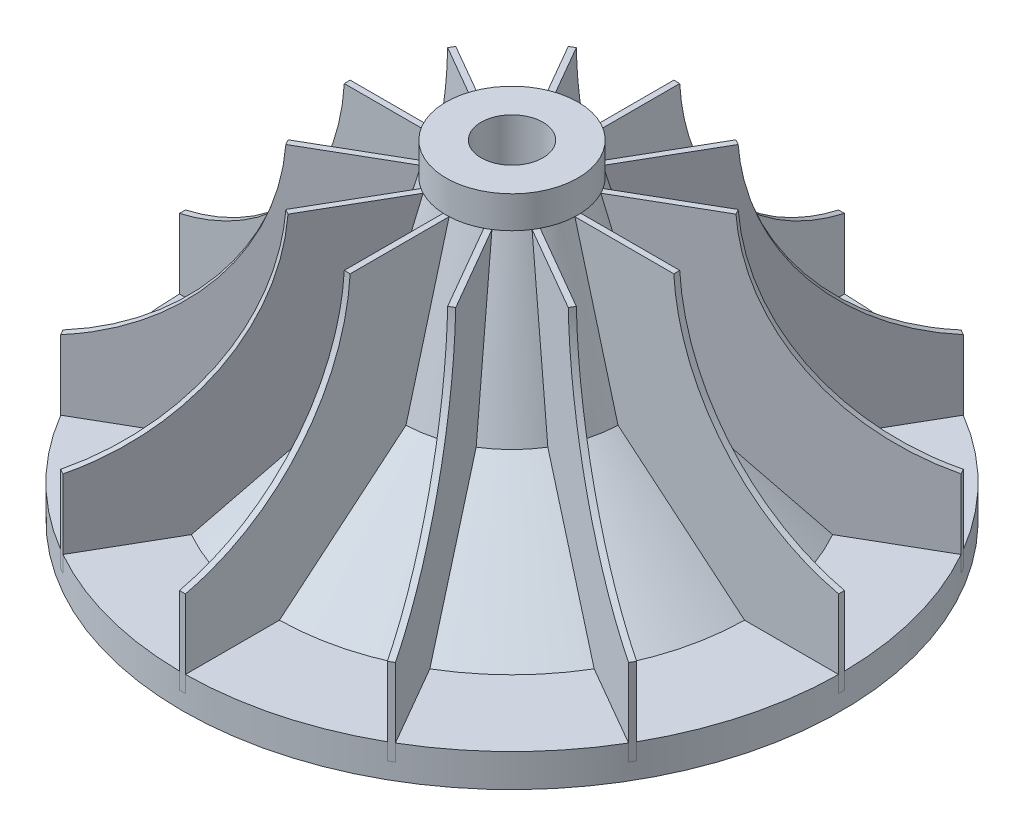
from build123d import *

# Parameters (mm, degrees)
SKETCH3_W           = 0.91186
SKETCH3_H           = 41.91
BOSS_EXTRUDE5_DEPTH = 48.26
CIRPATTERN8_COUNT   = 12
CUT_EXTRUDE1_REACH  = 89.988
SKETCH6_R           = 4.7625


with BuildPart() as part:
    # Sketch1 → Revolve1 (revolve)
    with BuildSketch(Plane.XY):
        Polygon((0, 0), (-50.8, 0), (-50.8, 5.08), (-36.306033809, 5.08), (-16.802789754, 21.352168612), (-10.16, 45.868150017), (-10.16, 50.8), (0, 50.8), align=None)
    revolve(axis=Axis((0, 0, 0), (0, 1, 0)))

    # Sketch3 → Boss-Extrude5 (add)
    with BuildSketch(Plane(origin=(0, 50.8, 0), x_dir=(1, 0, 0), z_dir=(0, 1, 0))):
        with Locations((0, -29.845)):
            Rectangle(SKETCH3_W, SKETCH3_H)
    boss_extrude5 = extrude(amount=-BOSS_EXTRUDE5_DEPTH)

    # CirPattern8: Boss-Extrude5 ×12 about axis
    cirpattern8_axis = Axis((0, 5.08, 0), (0, -1, 0))
    for i in range(1, CIRPATTERN8_COUNT):
        add(boss_extrude5.rotate(cirpattern8_axis, i * 360 / CIRPATTERN8_COUNT))

    # Sketch4 → Cut-Revolve1 (revolve, cut)
    with BuildSketch(Plane(origin=(0, 0, 0), x_dir=(0, 0, -1), z_dir=(1, 0, 0))):
        with BuildLine():
            Line((-53.34, 58.568150017), (-53.34, 15.388150017))
            Line((-53.34, 15.388150017), (-53.132221554, 15.388150017))
            ThreePointArc((-53.132221554, 15.388150017), (-33.885549763, 25.732647717), (-25.4, 45.868150017))
            Line((-25.4, 45.868150017), (-10.16, 45.868150017))
            Line((-10.16, 45.868150017), (-10.16, 51.095928276))
            Line((-10.16, 51.095928276), (-10.16, 59.620689016))
            Line((-10.16, 59.620689016), (-53.34, 58.568150017))
        make_face()
    revolve(axis=Axis((0, 0, 0), (0, 1, 0)), mode=Mode.SUBTRACT)

    # Sketch6 → Cut-Extrude1 (cut, up to next)
    with BuildSketch(Plane(origin=(0, 50.8, 0), x_dir=(1, 0, 0), z_dir=(0, 1, 0)), mode=Mode.PRIVATE) as cut_extrude1_sk1:
        Circle(SKETCH6_R)
    cut_extrude1_tool1 = extrude(cut_extrude1_sk1.sketch, amount=-CUT_EXTRUDE1_REACH, mode=Mode.PRIVATE) & part.part
    add(cut_extrude1_tool1.solids().sort_by_distance((0, 50.8, 0))[0], mode=Mode.SUBTRACT)


solid = part.part
